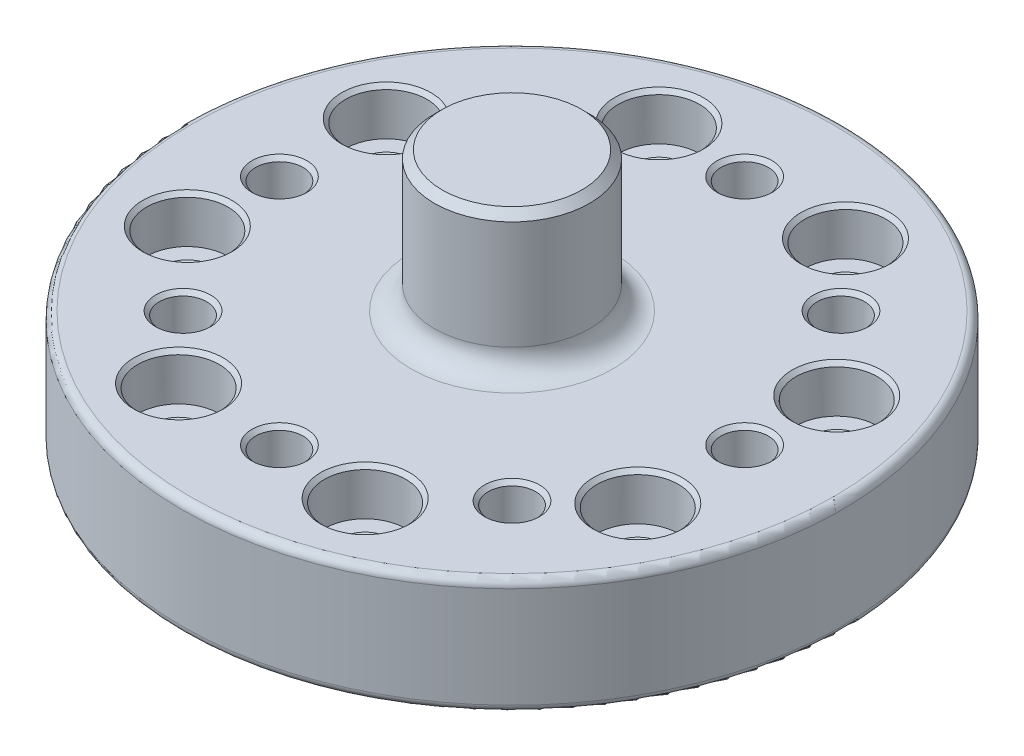
from build123d import *

# Parameters (mm, degrees)
SKETCH1_R                    = 42.5
BOSS_EXTRUDE1_DEPTH          = 15
SKETCH2_R                    = 3.05
CUT_EXTRUDE1_DEPTH           = 62.947558467
CIRPATTERN1_COUNT            = 8
SKETCH3_R                    = 10
BOSS_EXTRUDE2_DEPTH          = 18
FILLET1_R                    = 3
FILLET2_R                    = 1
CHAMFER1_SIZE                = 0.5
SKETCH4_R                    = 2.65
CUT_EXTRUDE2_DEPTH           = 63.741533361
SKETCH5_R                    = 5.25
CUT_EXTRUDE3_DEPTH           = 6
CHAMFER2_SIZE                = 0.5
CIRPATTERN2_COUNT            = 8
CHAMFER2_OF_CIRPATTERN2_SIZE = 0.5
CHAMFER3_SIZE                = 1


with BuildPart() as part:
    # Sketch1 → Boss-Extrude1 (new body)
    with BuildSketch(Plane(origin=(0, 0, 0), x_dir=(1, 0, 0), z_dir=(0, 1, 0))):
        Circle(SKETCH1_R)
    extrude(amount=BOSS_EXTRUDE1_DEPTH)

    # Sketch2 → Cut-Extrude1 (cut, through all)
    with BuildSketch(Plane(origin=(0, 15, 0), x_dir=(1, 0, 0), z_dir=(0, 1, 0))):
        with Locations((-30, 0)):
            Circle(SKETCH2_R)
    cut_extrude1 = extrude(amount=-CUT_EXTRUDE1_DEPTH, mode=Mode.SUBTRACT)

    # CirPattern1: Cut-Extrude1 ×8 about axis
    cirpattern1_axis = Axis((0, 15, 0), (0, 1, 0))
    for i in range(1, CIRPATTERN1_COUNT):
        add(cut_extrude1.rotate(cirpattern1_axis, i * 360 / CIRPATTERN1_COUNT), mode=Mode.SUBTRACT)

    # Sketch3 → Boss-Extrude2 (add)
    with BuildSketch(Plane(origin=(0, 15, 0), x_dir=(1, 0, 0), z_dir=(0, 1, 0))):
        Circle(SKETCH3_R)
    extrude(amount=BOSS_EXTRUDE2_DEPTH)

    # Fillet1
    fillet1_edges = [part.edges().sort_by_distance(p)[0] for p in [
        (-10, 15, 0),
    ]]
    fillet(fillet1_edges, radius=FILLET1_R)

    # Fillet2
    fillet2_edges = [part.edges().sort_by_distance(p)[0] for p in [
        (-42.5, 0, 0),
        (-42.5, 15, 0),
    ]]
    fillet(fillet2_edges, radius=FILLET2_R)

    # Chamfer1
    chamfer1_edges = [part.edges().sort_by_distance(p)[0] for p in [
        (0, 0, 33.05),
        (23.369879118, 0, 23.369879118),
        (33.05, 0, 0),
        (23.369879118, 0, -23.369879118),
        (0, 0, -33.05),
        (-23.369879118, 0, -23.369879118),
        (-33.05, 0, 0),
        (-23.369879118, 0, 23.369879118),
        (-23.369879118, 15, -23.369879118),
        (0, 15, -33.05),
        (23.369879118, 15, -23.369879118),
        (33.05, 15, 0),
        (23.369879118, 15, 23.369879118),
        (0, 15, 33.05),
        (-33.05, 15, 0),
        (-23.369879118, 15, 23.369879118),
    ]]
    chamfer(chamfer1_edges, length=CHAMFER1_SIZE)

    # Sketch4 → Cut-Extrude2 (cut, through all)
    with BuildSketch(Plane(origin=(0, 15, 0), x_dir=(1, 0, 0), z_dir=(0, 1, 0))):
        with Locations((-29.611702137, 13.393920133)):
            Circle(SKETCH4_R)
    cut_extrude2 = extrude(amount=-CUT_EXTRUDE2_DEPTH, mode=Mode.SUBTRACT)

    # Sketch5 → Cut-Extrude3 (cut)
    with BuildSketch(Plane(origin=(0, 15, 0), x_dir=(1, 0, 0), z_dir=(0, 1, 0))):
        with Locations((-29.611702137, 13.393920133)):
            Circle(SKETCH5_R)
    cut_extrude3 = extrude(amount=-CUT_EXTRUDE3_DEPTH, mode=Mode.SUBTRACT)

    # Chamfer2
    chamfer2_edges = [part.edges().sort_by_distance(p)[0] for p in [
        (-32.261702137, 0, -13.393920133),
        (-34.861702137, 15, -13.393920133),
        (-32.261702137, 9, -13.393920133),
    ]]
    chamfer(chamfer2_edges, length=CHAMFER2_SIZE)

    # CirPattern2: Cut-Extrude2, Cut-Extrude3 ×8 about axis
    cirpattern2_axis = Axis((0, 15, 0), (0, 1, 0))
    add([cut_extrude2.rotate(cirpattern2_axis, i * 360 / CIRPATTERN2_COUNT) for i in range(1, CIRPATTERN2_COUNT)], mode=Mode.SUBTRACT)
    add([cut_extrude3.rotate(cirpattern2_axis, i * 360 / CIRPATTERN2_COUNT) for i in range(1, CIRPATTERN2_COUNT)], mode=Mode.SUBTRACT)

    # Chamfer2 of CirPattern2
    chamfer2_of_cirpattern2_edges = [part.edges().sort_by_distance(p)[0] for p in [
        (-32.283400107, 0, 13.341536601),
        (-34.121877738, 15, 15.180014233),
        (-32.283400107, 9, 13.341536601),
        (-13.393920133, 0, 32.261702137),
        (-13.393920133, 15, 34.861702137),
        (-13.393920133, 9, 32.261702137),
        (13.341536601, 0, 32.283400107),
        (15.180014233, 15, 34.121877738),
        (13.341536601, 9, 32.283400107),
        (32.261702137, 0, 13.393920133),
        (34.861702137, 15, 13.393920133),
        (32.261702137, 9, 13.393920133),
        (32.283400107, 0, -13.341536601),
        (34.121877738, 15, -15.180014233),
        (32.283400107, 9, -13.341536601),
        (13.393920133, 0, -32.261702137),
        (13.393920133, 15, -34.861702137),
        (13.393920133, 9, -32.261702137),
        (-13.341536601, 0, -32.283400107),
        (-15.180014233, 15, -34.121877738),
        (-13.341536601, 9, -32.283400107),
    ]]
    chamfer(chamfer2_of_cirpattern2_edges, length=CHAMFER2_OF_CIRPATTERN2_SIZE)

    # Chamfer3
    chamfer3_edges = [part.edges().sort_by_distance(p)[0] for p in [
        (-10, 33, 0),
    ]]
    chamfer(chamfer3_edges, length=CHAMFER3_SIZE)


solid = part.part
